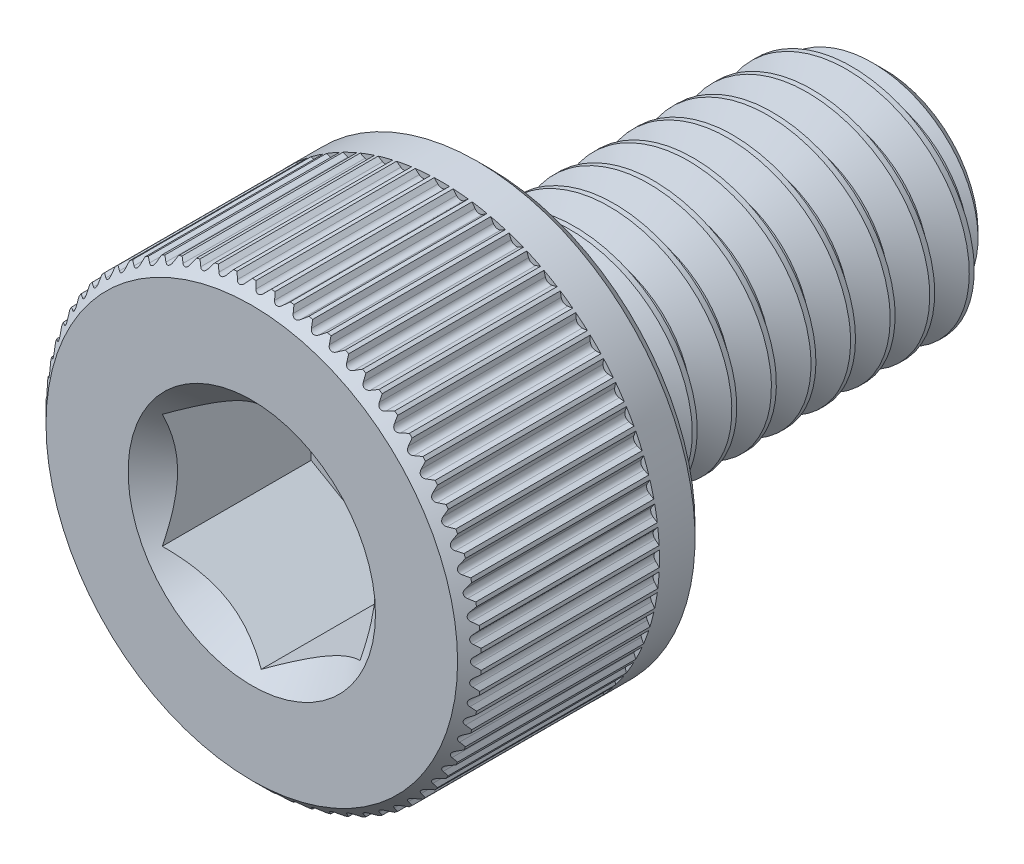
from build123d import *

# Parameters (mm, degrees)
CUT_EXTRUDE1_DEPTH     = 2
SKETCH4_R              = 1.5625
CUT_EXTRUDE2_DEPTH     = 1.5
CUT_EXTRUDE2_DRAFT     = -45
SPLIT1_SURFACE_1_BACK  = 12.158
SPLIT1_SURFACE_1_DEPTH = 24.316
SPLIT1_SURFACE_2_BACK  = 12.158
SPLIT1_SURFACE_2_DEPTH = 24.316
CUT_SWEEP1_PITCH       = 0.5
CUT_EXTRUDE3_DEPTH     = 2.4
CIRPATTERN1_COUNT      = 72


with BuildPart() as part:
    # Sketch2 → Revolve1 (revolve)
    with BuildSketch(Plane(origin=(0, 0, 0), x_dir=(0, 0, -1), z_dir=(1, 0, 0))):
        with BuildLine():
            Line((-4, 0), (-4, 2.6))
            Line((-4, 2.6), (-3.85, 2.75))
            Line((-3.85, 2.75), (-1.15, 2.75))
            Line((-1.15, 2.75), (-1, 2.6))
            Line((-1, 2.6), (-1, 1.65))
            ThreePointArc((-1, 1.65), (-0.956066017, 1.543933983), (-0.85, 1.5))
            Line((-0.85, 1.5), (3.675240474, 1.5))
            Line((3.675240474, 1.5), (4, 1.175240474))
            Line((4, 1.175240474), (4, 0))
            Line((4, 0), (-4, 0))
        make_face()
    revolve(axis=Axis((0, 0, -4), (0, 0, 1)))

    # Sketch3 → Cut-Extrude1 (cut)
    with BuildSketch(Plane.XY.offset(4)):
        Polygon((1.25, -0.721687836), (1.25, 0.721687836), (0, 1.443375673), (-1.25, 0.721687836), (-1.25, -0.721687836), (0, -1.443375673), align=None)
    extrude(amount=-CUT_EXTRUDE1_DEPTH, mode=Mode.SUBTRACT)


with BuildPart() as cut_extrude2_tool:
    # Sketch4 → Cut-Extrude2 (with draft: the straight prism first)
    with BuildSketch(Plane.XY.offset(4)):
        Circle(SKETCH4_R)
    extrude(amount=-CUT_EXTRUDE2_DEPTH)
    # Cut-Extrude2: the draft: its side faces are tilted about the plane it starts from
    cut_extrude2_sides = [cut_extrude2_tool.faces().sort_by_distance(p)[0] for p in [
        (-1.5625, 0, 3.25),
    ]]
    draft(cut_extrude2_sides, Plane.XY.offset(4), CUT_EXTRUDE2_DRAFT)


with BuildPart() as part_1:
    add(part.part)

    # Cut-Extrude2: cut by cut_extrude2_tool
    add(cut_extrude2_tool.part, mode=Mode.SUBTRACT)


with BuildPart() as body_2:
    # Split1: the piece behind the surface
    add(part_1.part)
    # Split1 surface: a surface, the sketch's curves swept straight by 24.316 mm
    with BuildLine(Plane(origin=(0, 0, 0), x_dir=(0, 0, -1), z_dir=(1, 0, 0)).offset(-SPLIT1_SURFACE_1_BACK), mode=Mode.PRIVATE) as split1_surface_1_path:
        Line((-0.85, -2.75), (-0.85, 2.75))
    split1_surface_1 = Shell.extrude(split1_surface_1_path.wire(), (1 * SPLIT1_SURFACE_1_DEPTH, 0 * SPLIT1_SURFACE_1_DEPTH, 0 * SPLIT1_SURFACE_1_DEPTH))
    split(bisect_by=split1_surface_1, keep=Keep.BOTTOM)

    # Cut-Sweep1: the profile of Sketch7 screwed along a right-hand helix of 11 turns, 6 arcs to a turn; built about Z, then put on its axis
    cut_sweep1_z = Axis((0, 0, 0), (0, 0, 1))
    cut_sweep1_corners = [(1.527063294, 0, 0.015625), (1.527063294, 0, -0.453125), (1.175240474, 0, -0.25), (1.175240474, 0, -0.1875)]
    with BuildLine(mode=Mode.PRIVATE) as cut_sweep1_profile:
        Line(cut_sweep1_corners[0], cut_sweep1_corners[1])
        Line(cut_sweep1_corners[1], cut_sweep1_corners[2])
        Line(cut_sweep1_corners[2], cut_sweep1_corners[3])
        Line(cut_sweep1_corners[3], cut_sweep1_corners[0])
    cut_sweep1_cap = Face(cut_sweep1_profile.wire())
    cut_sweep1_turn_angles = [0, 30, 60, 90, 120, 150, 180, 210, 240, 270, 300, 330, 360]
    cut_sweep1_turn_weights = [1, 0.8660254037844387, 1, 0.8660254037844387, 1, 0.8660254037844387, 1, 0.8660254037844387, 1, 0.8660254037844387, 1, 0.8660254037844387, 1]
    cut_sweep1_turn_rails = [Edge.make_bspline([Vector(p[0], p[1], 0).rotate(cut_sweep1_z, cut_sweep1_turn_angles[k]) / cut_sweep1_turn_weights[k] + Vector(0, 0, p[2] + CUT_SWEEP1_PITCH * cut_sweep1_turn_angles[k] / 360) for k in range(13)], [0, 0, 0, 1, 1, 2, 2, 3, 3, 4, 4, 5, 5, 6, 6, 6], 2, cut_sweep1_turn_weights) for p in cut_sweep1_corners]
    cut_sweep1_turn_sides = [Face.make_surface_from_curves(cut_sweep1_turn_rails[p[0]], cut_sweep1_turn_rails[p[1]]) for p in [(0, 1), (1, 2), (2, 3), (3, 0)]]
    cut_sweep1 = Plane(origin=(0, 0, -4), x_dir=(0, 1, 0), z_dir=(0, 0, 1)) * Solid(Shell([*[p.moved(Location((0, 0, CUT_SWEEP1_PITCH * i))) for i in range(11) for p in cut_sweep1_turn_sides], cut_sweep1_cap, cut_sweep1_cap.rotate(cut_sweep1_z, 3960).moved(Location((0, 0, CUT_SWEEP1_PITCH * 3960 / 360)))]))
    add(cut_sweep1, mode=Mode.SUBTRACT)


with BuildPart() as part_2:
    add(part_1.part)

    # Split1: split by a surface, the side it looks to stays
    # Split1 surface: a surface, the sketch's curves swept straight by 24.316 mm
    with BuildLine(Plane(origin=(0, 0, 0), x_dir=(0, 0, -1), z_dir=(1, 0, 0)).offset(-SPLIT1_SURFACE_2_BACK), mode=Mode.PRIVATE) as split1_surface_2_path:
        Line((-0.85, -2.75), (-0.85, 2.75))
    split1_surface_2 = Shell.extrude(split1_surface_2_path.wire(), (1 * SPLIT1_SURFACE_2_DEPTH, 0 * SPLIT1_SURFACE_2_DEPTH, 0 * SPLIT1_SURFACE_2_DEPTH))
    split(bisect_by=split1_surface_2, keep=Keep.TOP)

    add(body_2.part)  # Revolve2 merges body 2
    # Sketch8 → Revolve2 (revolve)
    with BuildSketch(Plane(origin=(0, 0, 0), x_dir=(0, 0, -1), z_dir=(1, 0, 0))):
        Polygon((-1, 0), (-1, 1.5), (-0.85, 1.5), (0.016025404, 0), align=None)
    revolve(axis=Axis((0, 0, -0.016025404), (0, 0, 1)))

    # Sketch12 → Cut-Extrude3 (cut)
    with BuildSketch(Plane.XY.offset(4)):
        with BuildLine():
            Line((-0.166398842, 2.81875), (0.166398842, 2.81875))
            Line((0.166398842, 2.81875), (0.049333409, 2.701684567))
            ThreePointArc((0.049333409, 2.701684567), (0, 2.68125), (-0.049333409, 2.701684567))
            Line((-0.049333409, 2.701684567), (-0.166398842, 2.81875))
        make_face()
    cut_extrude3 = extrude(amount=-CUT_EXTRUDE3_DEPTH, mode=Mode.SUBTRACT)

    # CirPattern1: Cut-Extrude3 ×72 about axis
    cirpattern1_axis = Axis((0, 0, 0), (0, 0, 1))
    for i in range(1, CIRPATTERN1_COUNT):
        add(cut_extrude3.rotate(cirpattern1_axis, i * 360 / CIRPATTERN1_COUNT), mode=Mode.SUBTRACT)


solid = part_2.part
